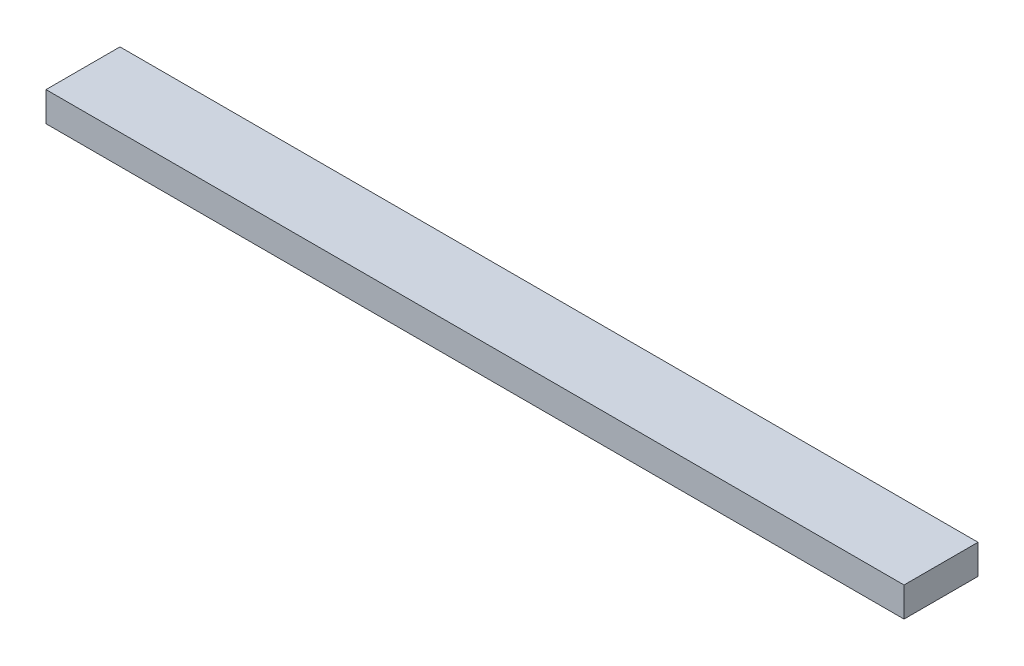
from build123d import *

# Parameters (mm, degrees)
SKETCH_1_W      = 290
SKETCH_1_H      = 25
EXTRUDE_1_DEPTH = 10


with BuildPart() as part:
    # Эскиз1 → Бобышка-Вытянуть1 (new body)
    with BuildSketch(Plane(origin=(0, 0, 0), x_dir=(1, 0, 0), z_dir=(0, 1, 0))):
        with Locations((145, 12.5)):
            Rectangle(SKETCH_1_W, SKETCH_1_H)
    extrude(amount=EXTRUDE_1_DEPTH)


solid = part.part
